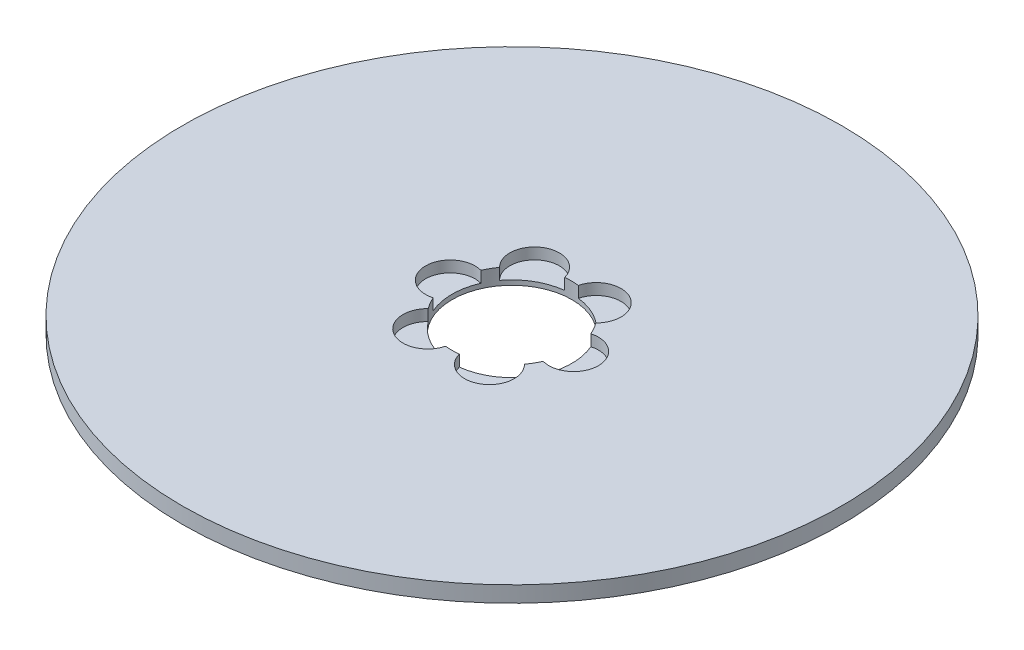
from build123d import *

# Parameters (mm, degrees)
SKETCH1_R           = 82.5
BOSS_EXTRUDE1_DEPTH = 4
SKETCH2_R           = 15
CUT_EXTRUDE1_DEPTH  = 117.741166689
SKETCH3_R           = 6.1968908
CUT_EXTRUDE2_DEPTH  = 2.811935487
CIRPATTERN1_COUNT   = 6


with BuildPart() as part:
    # Sketch1 → Boss-Extrude1 (new body)
    with BuildSketch(Plane(origin=(0, 0, 0), x_dir=(1, 0, 0), z_dir=(0, 1, 0))):
        Circle(SKETCH1_R)
    extrude(amount=BOSS_EXTRUDE1_DEPTH)

    # Sketch2 → Cut-Extrude1 (cut, through all)
    with BuildSketch(Plane(origin=(0, 0, 0), x_dir=(1, 0, 0), z_dir=(0, 1, 0))):
        Circle(SKETCH2_R)
    extrude(amount=CUT_EXTRUDE1_DEPTH, mode=Mode.SUBTRACT)

    # Sketch3 → Cut-Extrude2 (cut)
    with BuildSketch(Plane(origin=(0, 4, 0), x_dir=(1, 0, 0), z_dir=(0, 1, 0))):
        with Locations((-15.44198397, 0)):
            Circle(SKETCH3_R)
    cut_extrude2 = extrude(amount=-CUT_EXTRUDE2_DEPTH, mode=Mode.SUBTRACT)

    # CirPattern1: Cut-Extrude2 ×6 about axis
    cirpattern1_axis = Axis((0, 0, 0), (0, 1, 0))
    for i in range(1, CIRPATTERN1_COUNT):
        add(cut_extrude2.rotate(cirpattern1_axis, i * 360 / CIRPATTERN1_COUNT), mode=Mode.SUBTRACT)


solid = part.part
